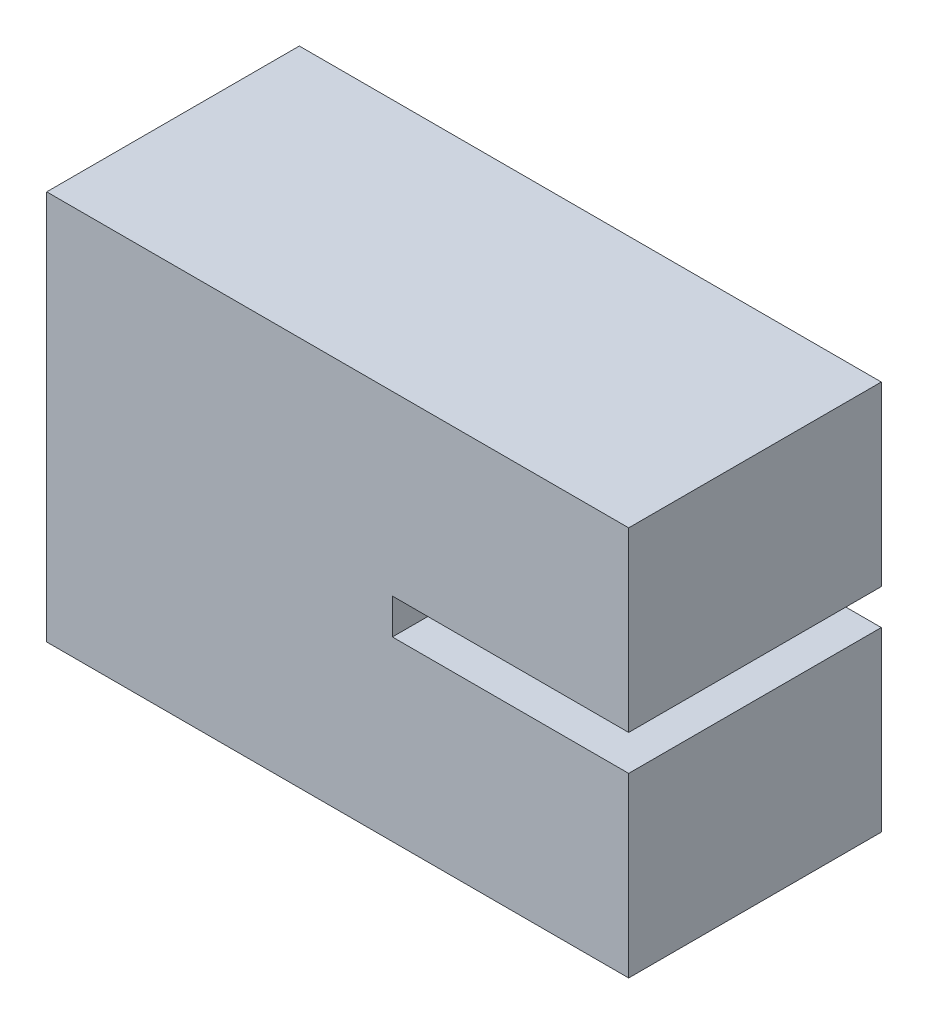
from build123d import *

# Parameters (mm, degrees)
BOSS_EXTRUDE1_DEPTH = 8.552959


with BuildPart() as part:
    # Sketch1 → Boss-Extrude1 (new body)
    with BuildSketch(Plane.XY):
        Polygon((0, 0), (0, 13.2), (19.704590583, 13.2), (19.704590583, 7.2), (11.704590583, 7.2), (11.704590583, 6), (19.704590583, 6), (19.704590583, 0), align=None)
    extrude(amount=BOSS_EXTRUDE1_DEPTH)


solid = part.part
